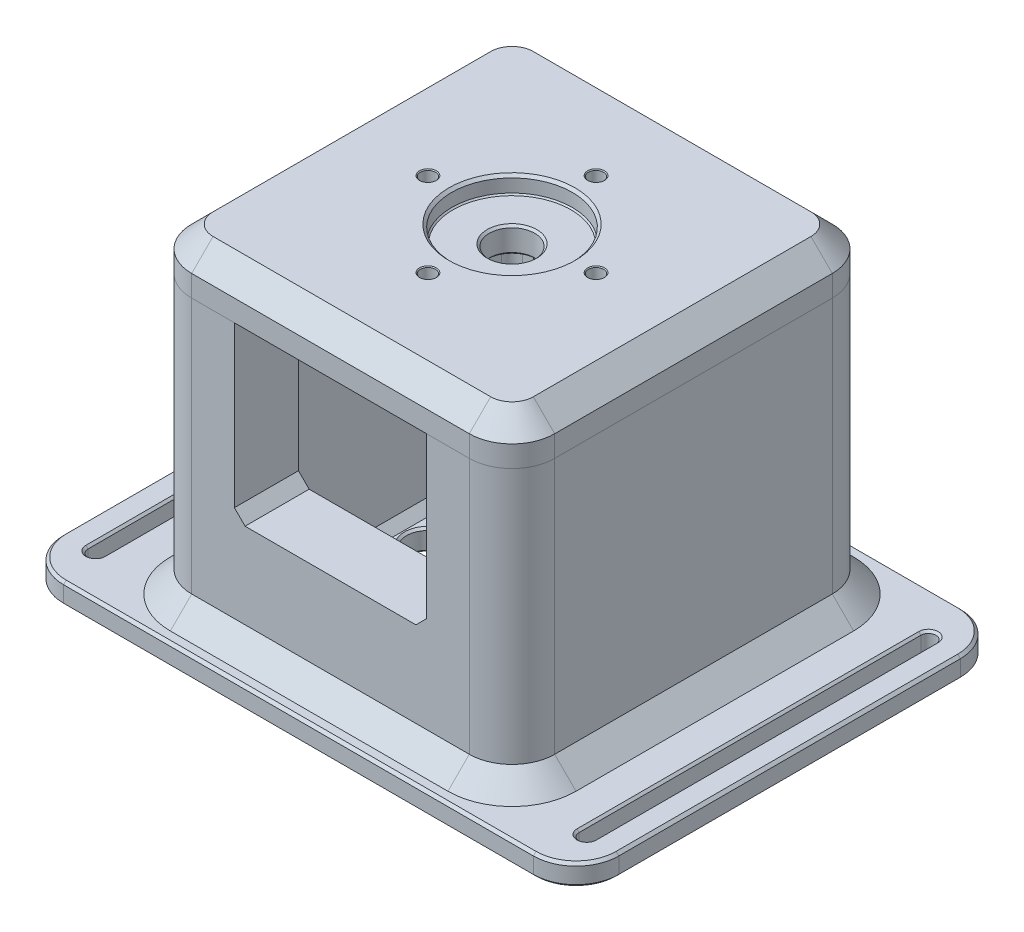
from build123d import *

# Parameters (mm, degrees)
SKETCH1_W                   = 165.1
SKETCH1_H                   = 127
BOSS_EXTRUDE1_DEPTH         = 6.35
SKETCH2_W                   = 57.15
SKETCH2_H                   = 19.05
BOSS_EXTRUDE2_DEPTH         = 38.1
BOSS_EXTRUDE3_DEPTH         = 88.9
BOSS_EXTRUDE4_START         = 88.9
SKETCH2_4_W                 = 57.15
SKETCH2_4_H                 = 19.05
SKETCH2_4_W_2               = 69.85
SKETCH2_4_H_2               = 69.85
BOSS_EXTRUDE4_DEPTH         = 12.7
CUT_EXTRUDE1_DEPTH          = 146.496778315
CUT_EXTRUDE1_DEPTH_BACK     = 5.08
SKETCH7_R                   = 17.9578
F_8_START                   = -50.8
F_8_CLEARANCE_SLOT1_2_DEPTH = 101.6
CIRPATTERN1_COUNT           = 4
F_3_8_START                 = 25.4
F_3_8_CLEARANCE_SLOT1_DEPTH = 12.7
FILLET2_R                   = 3.175
FILLET1_R                   = 12.7
CHAMFER1_SIZE               = 2.54
CHAMFER8_SIZE               = 6.35
CHAMFER2_SIZE               = 6.35
CHAMFER9_SIZE               = 3.175
CHAMFER3_SIZE               = 0.79375
CHAMFER5_SIZE               = 0.79375
CHAMFER6_SIZE               = 0.396875


with BuildPart() as part:
    # Sketch1 → Boss-Extrude1 (new body)
    with BuildSketch(Plane(origin=(0, 0, 0), x_dir=(1, 0, 0), z_dir=(0, 1, 0))):
        Rectangle(SKETCH1_W, SKETCH1_H)
    extrude(amount=BOSS_EXTRUDE1_DEPTH)

    # Sketch2 → Boss-Extrude2 (add)
    with BuildSketch(Plane(origin=(0, 0, 0), x_dir=(1, 0, 0), z_dir=(0, 1, 0))):
        Polygon((-28.575, 53.975), (-53.975, 53.975), (-53.975, -53.975), (-28.575, -53.975), (-28.575, -34.925), (-34.925, -34.925), (-34.925, 34.925), (-28.575, 34.925), align=None)
        with Locations((0, 44.45)):
            Rectangle(SKETCH2_W, SKETCH2_H)
        Polygon((53.975, 53.975), (28.575, 53.975), (28.575, 34.925), (34.925, 34.925), (34.925, -34.925), (28.575, -34.925), (28.575, -53.975), (53.975, -53.975), align=None)
        with Locations((0, -44.45)):
            Rectangle(SKETCH2_W, SKETCH2_H)
    extrude(amount=BOSS_EXTRUDE2_DEPTH)

    # Sketch2<3> → Boss-Extrude3 (add)
    with BuildSketch(Plane(origin=(0, 0, 0), x_dir=(1, 0, 0), z_dir=(0, 1, 0))):
        Polygon((-28.575, 53.975), (-53.975, 53.975), (-53.975, -53.975), (-28.575, -53.975), (-28.575, -34.925), (-34.925, -34.925), (-34.925, 34.925), (-28.575, 34.925), align=None)
        Polygon((53.975, 53.975), (28.575, 53.975), (28.575, 34.925), (34.925, 34.925), (34.925, -34.925), (28.575, -34.925), (28.575, -53.975), (53.975, -53.975), align=None)
    extrude(amount=BOSS_EXTRUDE3_DEPTH)

    # Sketch2<4> → Boss-Extrude4 (add)
    with BuildSketch(Plane(origin=(0, 0, 0), x_dir=(1, 0, 0), z_dir=(0, 1, 0)).offset(BOSS_EXTRUDE4_START)):
        with Locations((0, 44.45)):
            Rectangle(SKETCH2_4_W, SKETCH2_4_H)
        Polygon((-28.575, 53.975), (-53.975, 53.975), (-53.975, -53.975), (-28.575, -53.975), (-28.575, -34.925), (-34.925, -34.925), (-34.925, 34.925), (-28.575, 34.925), align=None)
        with Locations((0, -44.45)):
            Rectangle(SKETCH2_4_W, SKETCH2_4_H)
        Polygon((53.975, 53.975), (28.575, 53.975), (28.575, 34.925), (34.925, 34.925), (34.925, -34.925), (28.575, -34.925), (28.575, -53.975), (53.975, -53.975), align=None)
        Rectangle(SKETCH2_4_W_2, SKETCH2_4_H_2)
    extrude(amount=BOSS_EXTRUDE4_DEPTH)

    # Sketch7 → Cut-Extrude1 (cut, two sides: drawn at the far end of the back side and taken through both)
    with BuildSketch(Plane(origin=(0, 101.6, 0), x_dir=(1, 0, 0), z_dir=(0, 1, 0)).offset(-CUT_EXTRUDE1_DEPTH_BACK)):
        with Locations(Location((0, 0, 0), (0, 0, 90))):
            Circle(SKETCH7_R)
    extrude(amount=CUT_EXTRUDE1_DEPTH + CUT_EXTRUDE1_DEPTH_BACK, mode=Mode.SUBTRACT)

    # Sketch19 → 1/2 Clearance Hole1 (revolve, cut)
    with BuildSketch(Plane(origin=(0, 96.52, 0), x_dir=(0, 0, 1), z_dir=(1, 0, 0))):
        Polygon((0, 0), (0, 7.62), (7.38124, 7.62), (6.74624, 6.985), (6.74624, 0.635), (7.38124, 0), align=None)
    revolve(axis=Axis((0, 102.87, 0), (0, -1, 0)), mode=Mode.SUBTRACT)

    # #8 Clearance Slot1: read off the stored shape, not the designer's step
    # #8 Clearance Slot1 outline → #8 Clearance Slot1 (revolve, cut)
    with BuildSketch(Plane(origin=(73.025, 0, -50.8), x_dir=(1, 0, 0), z_dir=(0, 0, 1))):
        Polygon((0, 0), (2.8829, 0), (2.2479, 0.635), (2.2479, 5.715), (2.8829, 6.35), (0, 6.35), align=None)
    revolve(axis=Axis((73.025, 0, -50.8), (0, 1, 0)), mode=Mode.SUBTRACT)

    # 8 Clearance Slot1 2 outline → 8 Clearance Slot1 2 (cut)
    with BuildSketch(Plane.XY.offset(F_8_START)):
        Polygon((75.9079, 6.35), (70.1421, 6.35), (70.7771, 5.715), (70.7771, 0.635), (70.1421, 0), (75.9079, 0), (75.2729, 0.635), (75.2729, 5.715), align=None)
        Polygon((-70.7771, 5.715), (-70.1421, 6.35), (-75.9079, 6.35), (-75.2729, 5.715), (-75.2729, 0.635), (-75.9079, 0), (-70.1421, 0), (-70.7771, 0.635), align=None)
    extrude(amount=F_8_CLEARANCE_SLOT1_2_DEPTH, mode=Mode.SUBTRACT)

    # 8 Clearance Slot1 3 outline → 8 Clearance Slot1 3 (revolve, cut)
    with BuildSketch(Plane(origin=(73.025, 0, 50.8), x_dir=(1, 0, 0), z_dir=(0, 0, 1))):
        Polygon((0, 0), (2.8829, 0), (2.2479, 0.635), (2.2479, 5.715), (2.8829, 6.35), (0, 6.35), align=None)
    revolve(axis=Axis((73.025, 0, 50.8), (0, 1, 0)), mode=Mode.SUBTRACT)

    # 8 Clearance Slot1 4 outline → 8 Clearance Slot1 4 (revolve, cut)
    with BuildSketch(Plane(origin=(-73.025, 0, -50.8), x_dir=(1, 0, 0), z_dir=(0, 0, 1))):
        Polygon((0, 0), (2.8829, 0), (2.2479, 0.635), (2.2479, 5.715), (2.8829, 6.35), (0, 6.35), align=None)
    revolve(axis=Axis((-73.025, 0, -50.8), (0, 1, 0)), mode=Mode.SUBTRACT)

    # 8 Clearance Slot1 5 outline → 8 Clearance Slot1 5 (revolve, cut)
    with BuildSketch(Plane(origin=(-73.025, 0, 50.8), x_dir=(1, 0, 0), z_dir=(0, 0, 1))):
        Polygon((0, 0), (2.8829, 0), (2.2479, 0.635), (2.2479, 5.715), (2.8829, 6.35), (0, 6.35), align=None)
    revolve(axis=Axis((-73.025, 0, 50.8), (0, 1, 0)), mode=Mode.SUBTRACT)

    # Sketch11 → 1/2 (0.5) Diameter Hole1 (revolve, cut)
    with BuildSketch(Plane(origin=(25, 0, 0), x_dir=(0, 0, -1), z_dir=(1, 0, 0))):
        Polygon((0, 0), (0, 6.35), (6.985, 6.35), (6.35, 5.715), (6.35, 0.635), (6.985, 0), align=None)
    f_1_2_0_5_diameter_hole1 = revolve(axis=Axis((25, -6.35, 0), (0, 1, 0)), mode=Mode.SUBTRACT)

    # Sketch13 → #8 Clearance Hole2 (revolve, cut)
    with BuildSketch(Plane(origin=(25, 88.9, 0), x_dir=(0, 0, -1), z_dir=(1, 0, 0))):
        Polygon((0, 0), (0, 12.7), (2.5019, 12.7), (2.2479, 12.446), (2.2479, 0.635), (2.8829, 0), align=None)
    f_8_clearance_hole2 = revolve(axis=Axis((25, 82.55, 0), (0, 1, 0)), mode=Mode.SUBTRACT)

    # CirPattern1: 1/2 (0.5) Diameter Hole1, #8 Clearance Hole2 ×4 about axis
    cirpattern1_axis = Axis((0, 0, 0), (0, 1, 0))
    add([f_1_2_0_5_diameter_hole1.rotate(cirpattern1_axis, i * 360 / CIRPATTERN1_COUNT) for i in range(1, CIRPATTERN1_COUNT)], mode=Mode.SUBTRACT)
    add([f_8_clearance_hole2.rotate(cirpattern1_axis, i * 360 / CIRPATTERN1_COUNT) for i in range(1, CIRPATTERN1_COUNT)], mode=Mode.SUBTRACT)

    # 3/8 Clearance Slot1: read off the stored shape, not the designer's step
    # 3/8 Clearance Slot1 outline → 3/8 Clearance Slot1 (cut)
    with BuildSketch(Plane(origin=(0, 0, 0), x_dir=(1, 0, 0), z_dir=(0, 1, 0)).offset(F_3_8_START)):
        Polygon((4.9022, 53.34), (5.5372, 53.975), (-5.5372, 53.975), (-4.9022, 53.34), (-4.9022, 35.56), (-5.5372, 34.925), (5.5372, 34.925), (4.9022, 35.56), align=None)
    extrude(amount=F_3_8_CLEARANCE_SLOT1_DEPTH, mode=Mode.SUBTRACT)

    # 3_8 Clearance Slot1 2 outline → 3_8 Clearance Slot1 2 (revolve, cut)
    with BuildSketch(Plane.XZ.offset(-25.4)):
        Polygon((5.5372, -34.925), (0, -34.925), (0, -53.975), (5.5372, -53.975), (4.9022, -53.34), (4.9022, -35.56), align=None)
    revolve(axis=Axis((0, 25.4, 0), (0, 0, 1)), mode=Mode.SUBTRACT)

    # Fillet2
    fillet2_edges = [part.edges().sort_by_distance(p)[0] for p in [
        (-34.925, 47.625, -34.925),
        (34.925, 47.625, -34.925),
        (34.925, 47.625, 34.925),
        (-34.925, 47.625, 34.925),
    ]]
    fillet(fillet2_edges, radius=FILLET2_R)

    # Fillet1
    fillet1_edges = [part.edges().sort_by_distance(p)[0] for p in [
        (53.975, 53.975, 53.975),
        (53.975, 53.975, -53.975),
        (-53.975, 53.975, -53.975),
        (-53.975, 53.975, 53.975),
        (82.55, 3.175, 63.5),
        (-82.55, 3.175, 63.5),
        (-82.55, 3.175, -63.5),
        (82.55, 3.175, -63.5),
    ]]
    fillet(fillet1_edges, radius=FILLET1_R)

    # Chamfer1
    chamfer1_edges = [part.edges().sort_by_distance(p)[0] for p in [
        (0, 6.35, -34.925),
        (-34.925, 6.35, 0),
        (0, 6.35, 34.925),
        (34.925, 6.35, 0),
        (33.99506403, 6.35, 33.99506403),
        (-33.99506403, 6.35, 33.99506403),
        (33.99506403, 6.35, -33.99506403),
        (-33.99506403, 6.35, -33.99506403),
    ]]
    chamfer(chamfer1_edges, length=CHAMFER1_SIZE)

    # Chamfer8
    chamfer8_edges = [part.edges().sort_by_distance(p)[0] for p in [
        (53.975, 6.35, 0),
        (0, 6.35, 53.975),
        (-53.975, 6.35, 0),
        (0, 6.35, -53.975),
        (-50.255256121, 6.35, -50.255256121),
        (50.255256121, 6.35, -50.255256121),
        (50.255256121, 6.35, 50.255256121),
        (-50.255256121, 6.35, 50.255256121),
    ]]
    chamfer(chamfer8_edges, length=CHAMFER8_SIZE)

    # Chamfer2
    chamfer2_edges = [part.edges().sort_by_distance(p)[0] for p in [
        (-53.975, 101.6, 0),
        (0, 101.6, -53.975),
        (0, 101.6, 53.975),
        (53.975, 101.6, 0),
        (-50.255256121, 101.6, 50.255256121),
        (50.255256121, 101.6, 50.255256121),
        (50.255256121, 101.6, -50.255256121),
        (-50.255256121, 101.6, -50.255256121),
    ]]
    chamfer(chamfer2_edges, length=CHAMFER2_SIZE)

    # Chamfer9
    chamfer9_edges = [part.edges().sort_by_distance(p)[0] for p in [
        (28.575, 38.1, -44.45),
        (28.575, 38.1, 44.45),
        (-4.9022, 38.1, -44.45),
        (4.9022, 38.1, -44.45),
        (-28.575, 38.1, 44.45),
        (-28.575, 38.1, -44.45),
    ]]
    chamfer(chamfer9_edges, length=CHAMFER9_SIZE)

    # Chamfer3
    chamfer3_edges = [part.edges().sort_by_distance(p)[0] for p in [
        (0, 0, -63.5),
        (0, 6.35, -63.5),
        (82.55, 0, 0),
        (0, 0, 63.5),
        (-82.55, 0, 0),
        (78.830256121, 0, 59.780256121),
        (-78.830256121, 0, 59.780256121),
        (-78.830256121, 0, -59.780256121),
        (78.830256121, 0, -59.780256121),
        (82.55, 6.35, 0),
        (-82.55, 6.35, 0),
        (0, 6.35, 63.5),
        (78.830256121, 6.35, 59.780256121),
        (-78.830256121, 6.35, 59.780256121),
        (-78.830256121, 6.35, -59.780256121),
        (78.830256121, 6.35, -59.780256121),
    ]]
    chamfer(chamfer3_edges, length=CHAMFER3_SIZE)

    # Chamfer5
    chamfer5_edges = [part.edges().sort_by_distance(p)[0] for p in [
        (0, 101.6, 17.9578),
    ]]
    chamfer(chamfer5_edges, length=CHAMFER5_SIZE)

    # Chamfer6
    chamfer6_edges = [part.edges().sort_by_distance(p)[0] for p in [
        (0, 96.52, 17.9578),
    ]]
    chamfer(chamfer6_edges, length=CHAMFER6_SIZE)


with BuildPart() as body_2:
    # Split1: the piece on the far side of the plane
    add(part.part)
    split(bisect_by=Plane.ZX.offset(88.9), keep=Keep.BOTTOM)


with BuildPart() as part_1:
    add(part.part)

    # Split1
    split(bisect_by=Plane.ZX.offset(88.9), keep=Keep.TOP)


solid = Compound([body_2.part, part_1.part])
